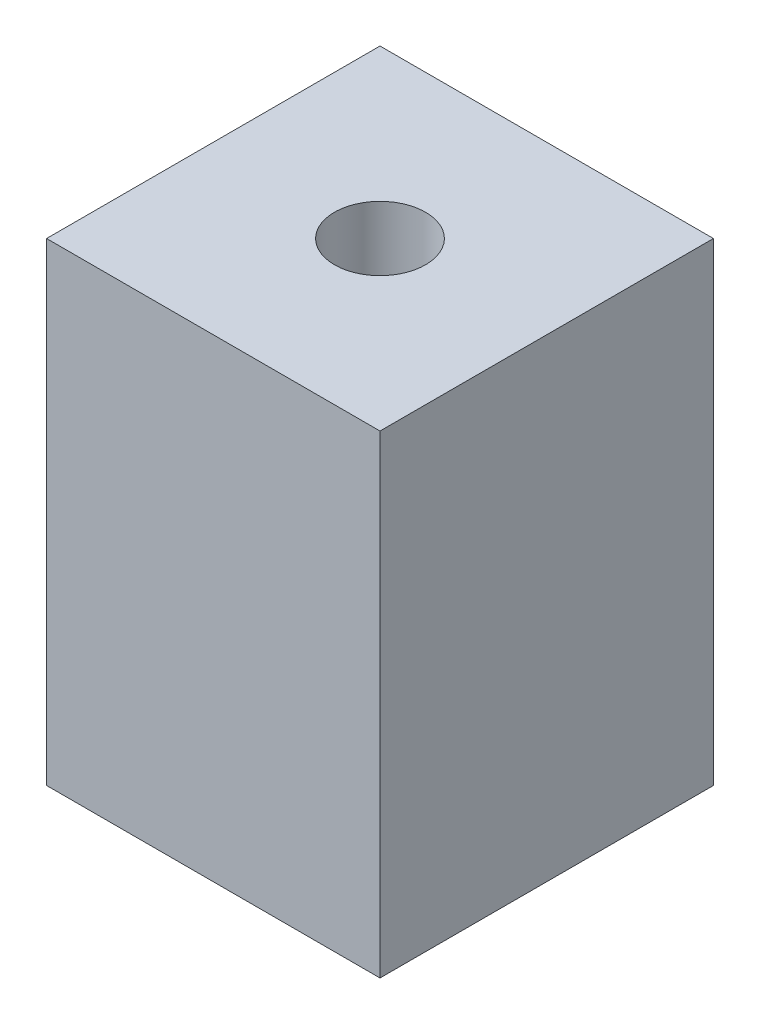
from build123d import *

# Parameters (mm, degrees)
SKETCH2_W           = 46.482
SKETCH2_H           = 46.482
BOSS_EXTRUDE1_DEPTH = 66.04
SKETCH3_R           = 6.35
CUT_EXTRUDE1_DEPTH  = 12.7
CUT_EXTRUDE2_START  = -12.7
SKETCH4_R           = 6.35
CUT_EXTRUDE2_DEPTH  = 12.7


with BuildPart() as part:
    # Sketch2 → Boss-Extrude1 (new body)
    with BuildSketch(Plane(origin=(0, 0, 0), x_dir=(1, 0, 0), z_dir=(0, 1, 0))):
        Rectangle(SKETCH2_W, SKETCH2_H)
    extrude(amount=BOSS_EXTRUDE1_DEPTH)

    # Sketch3 → Cut-Extrude1 (cut)
    with BuildSketch(Plane(origin=(0, 66.04, 0), x_dir=(1, 0, 0), z_dir=(0, 1, 0))):
        Circle(SKETCH3_R)
    extrude(amount=-CUT_EXTRUDE1_DEPTH, mode=Mode.SUBTRACT)

    # Sketch4 → Cut-Extrude2 (cut)
    with BuildSketch(Plane.XZ.offset(CUT_EXTRUDE2_START)):
        Circle(SKETCH4_R)
    extrude(amount=CUT_EXTRUDE2_DEPTH, mode=Mode.SUBTRACT)


solid = part.part
